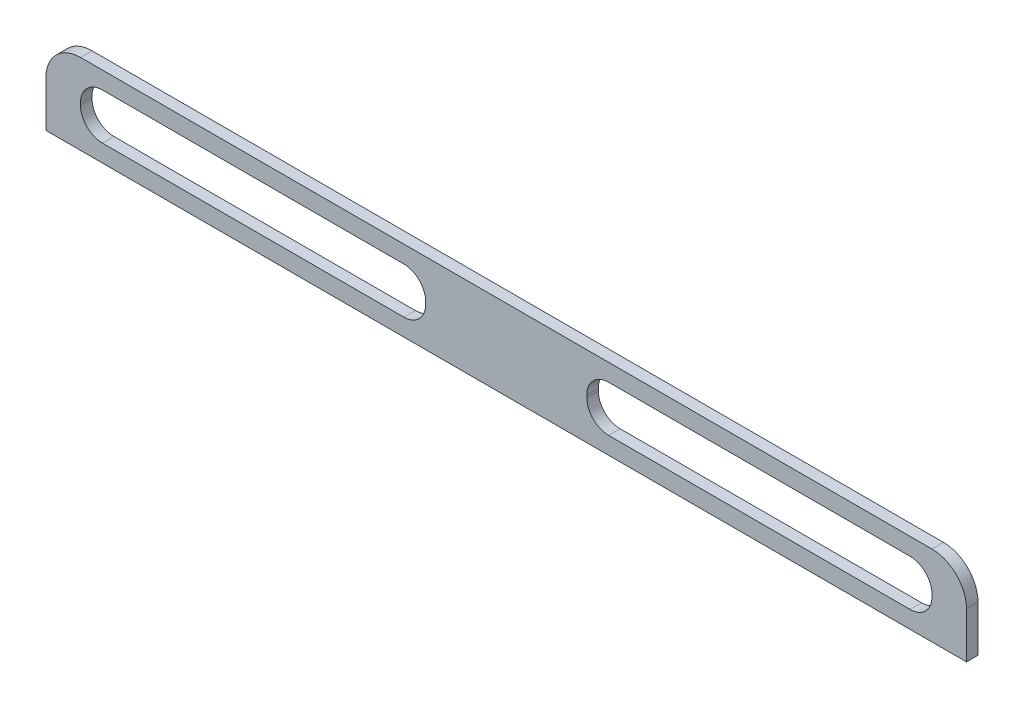
from build123d import *

# Parameters (mm, degrees)
TABAN_FLAN_1_DEPTH = 10


# Sheet-metal steps are written as plain solids
with BuildPart() as part:
    # Çizim1 → Taban-Flanş1 (new body)
    with BuildSketch(Plane.XY):
        with BuildLine():
            Line((400, -35), (-400, -35))
            Line((-400, -35), (-400, 5))
            ThreePointArc((-400, 5), (-391.213203436, 26.213203436), (-370, 35))
            Line((-370, 35), (370, 35))
            ThreePointArc((370, 35), (391.213203436, 26.213203436), (400, 5))
            Line((400, 5), (400, -35))
        make_face()
        with BuildLine():
            Line((351, 20), (89, 20))
            ThreePointArc((89, 20), (75.564971157, 14.435028843), (70, 1))
            Line((70, 1), (70, -1))
            ThreePointArc((70, -1), (75.564971157, -14.435028843), (89, -20))
            Line((89, -20), (351, -20))
            ThreePointArc((351, -20), (364.435028843, -14.435028843), (370, -1))
            Line((370, -1), (370, 1))
            ThreePointArc((370, 1), (364.435028843, 14.435028843), (351, 20))
        make_face(mode=Mode.SUBTRACT)
        with BuildLine():
            Line((-70, 1), (-70, -1))
            ThreePointArc((-70, -1), (-75.564971157, -14.435028843), (-89, -20))
            Line((-89, -20), (-351, -20))
            ThreePointArc((-351, -20), (-364.435028843, -14.435028843), (-370, -1))
            Line((-370, -1), (-370, 1))
            ThreePointArc((-370, 1), (-364.435028843, 14.435028843), (-351, 20))
            Line((-351, 20), (-89, 20))
            ThreePointArc((-89, 20), (-75.564971157, 14.435028843), (-70, 1))
        make_face(mode=Mode.SUBTRACT)
    extrude(amount=-TABAN_FLAN_1_DEPTH)


solid = part.part
